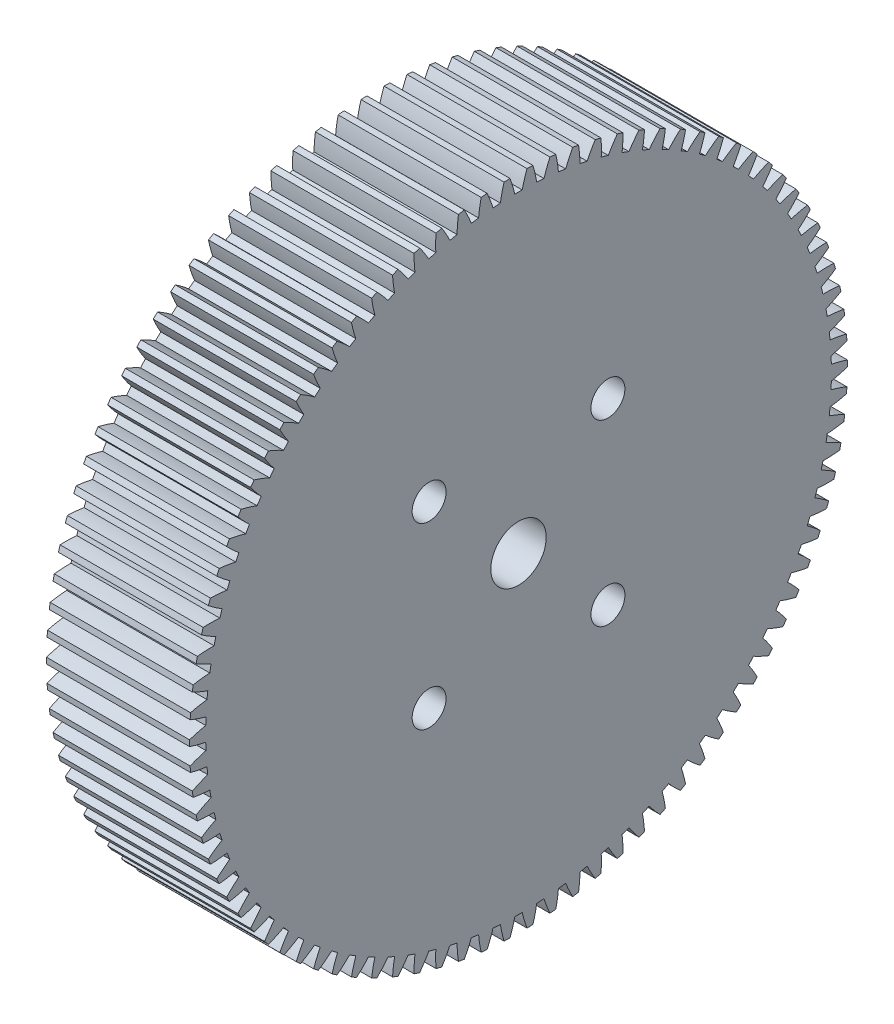
from build123d import *

# Parameters (mm, degrees)
BASPROSKE_W           = 16
BASPROSKE_H           = 36.8
TOOTHCUT_DEPTH        = 55.447038487
TEETHCUTS_COUNT       = 90
BORSKE_R              = 3
BORE_DEPTH            = 50.0000508
F_6_CLEARANCE_HOLE1_D = 3.7973
SKETCH4_R             = 3.1
CUT_EXTRUDE1_DEPTH    = 16


with BuildPart() as part:
    # BasProSke → Base-Revolve (revolve)
    with BuildSketch(Plane(origin=(0, 0, 0), x_dir=(1, 0, 0), z_dir=(0, 1, 0)), mode=Mode.PRIVATE) as base_revolve_sk:
        with Locations((8, 18.4)):
            Rectangle(BASPROSKE_W, BASPROSKE_H)
    revolve(base_revolve_sk.sketch.rotate(Axis((-10, 0, 0), (1, 0, 0)), 180), axis=Axis((-10, 0, 0), (1, 0, 0)))

    # TooCutSke → ToothCut (cut, through all)
    with BuildSketch(Plane(origin=(0, 0, 0), x_dir=(0, 0, -1), z_dir=(1, 0, 0))):
        with BuildLine():
            ThreePointArc((0.41009472, 34.996597311), (0, 34.999), (-0.41009472, 34.996597311))
            ThreePointArc((-0.41009472, 34.996597311), (-0.656283898, 35.913820865), (-0.962396213, 36.812822205))
            ThreePointArc((-0.962396213, 36.812822205), (0, 36.8254), (0.962396213, 36.812822205))
            ThreePointArc((0.962396213, 36.812822205), (0.656283898, 35.913820865), (0.41009472, 34.996597311))
        make_face()
    toothcut = extrude(amount=TOOTHCUT_DEPTH, mode=Mode.SUBTRACT)

    # TeethCuts: ToothCut ×90 about axis
    teethcuts_axis = Axis((0, 0, 0), (1, 0, 0))
    for i in range(1, TEETHCUTS_COUNT):
        add(toothcut.rotate(teethcuts_axis, i * 360 / TEETHCUTS_COUNT), mode=Mode.SUBTRACT)

    # BorSke → Bore (cut, symmetric)
    with BuildSketch(Plane(origin=(0, 0, 0), x_dir=(0, 0, -1), z_dir=(1, 0, 0))):
        with Locations(Location((0, 0, 0), (0, 0, 180))):
            Circle(BORSKE_R)
    extrude(amount=BORE_DEPTH, both=True, mode=Mode.SUBTRACT)

    # #6 Clearance Hole1 (through all)
    with Locations(Plane(origin=(16, 0, 0), x_dir=(0, 0, -1), z_dir=(1, 0, 0))):
        with Locations((-10, -10), (10, -10), (-10, 10), (10, 10)):
            Hole(F_6_CLEARANCE_HOLE1_D / 2)

    # Sketch4 → Cut-Extrude1 (cut)
    with BuildSketch(Plane(origin=(16, 0, 0), x_dir=(0, 0, -1), z_dir=(1, 0, 0))):
        Circle(SKETCH4_R)
    extrude(amount=-CUT_EXTRUDE1_DEPTH, mode=Mode.SUBTRACT)


solid = part.part
